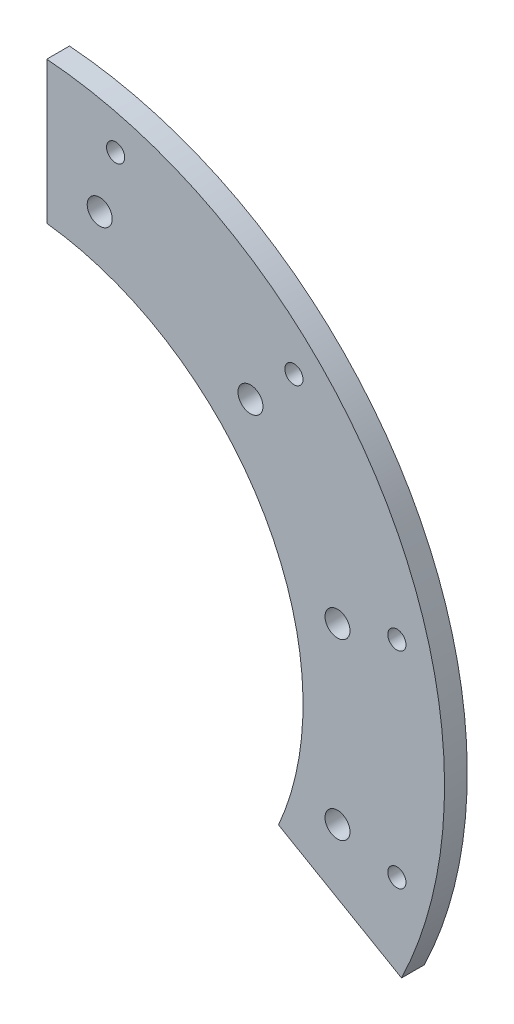
from build123d import *

# Parameters (mm, degrees)
BOSS_EXTRU_1_DEPTH = 4
SKETCH2_R          = 1.6
SKETCH2_R_2        = 2.2
CUT_EXTRUDE1_DEPTH = 108.387150069
CIRPATTERN1_COUNT  = 12


with BuildPart() as part:
    # Esquisse1 → Boss.-Extru.1 (new body)
    with BuildSketch(Plane.XY):
        with BuildLine():
            Line((6, 75.7627877), (6, 50.746526975))
            ThreePointArc((6, 50.746526975), (44.357130232, 25.37035667), (46.782617658, -20.557156541))
            Line((46.782617658, -20.557156541), (68.433905861, -33.057533613))
            ThreePointArc((68.433905861, -33.057533613), (65.920916014, 37.821063337), (6, 75.7627877))
        make_face()
    extrude(amount=BOSS_EXTRU_1_DEPTH)

    # Sketch2 → Cut-Extrude1 (cut, through all)
    with BuildSketch(Plane.XY.offset(4)):
        with Locations((18.117333157, 67.61480784)):
            Circle(SKETCH2_R)
        with Locations((15.316911089, 57.1634904)):
            Circle(SKETCH2_R_2)
    cut_extrude1 = extrude(amount=-CUT_EXTRUDE1_DEPTH, mode=Mode.SUBTRACT)

    # CirPattern1: Cut-Extrude1 ×12 about axis
    cirpattern1_axis = Axis((0, 0, -0.2), (0, 0, 1))
    for i in range(1, CIRPATTERN1_COUNT):
        add(cut_extrude1.rotate(cirpattern1_axis, i * 360 / CIRPATTERN1_COUNT), mode=Mode.SUBTRACT)


solid = part.part
